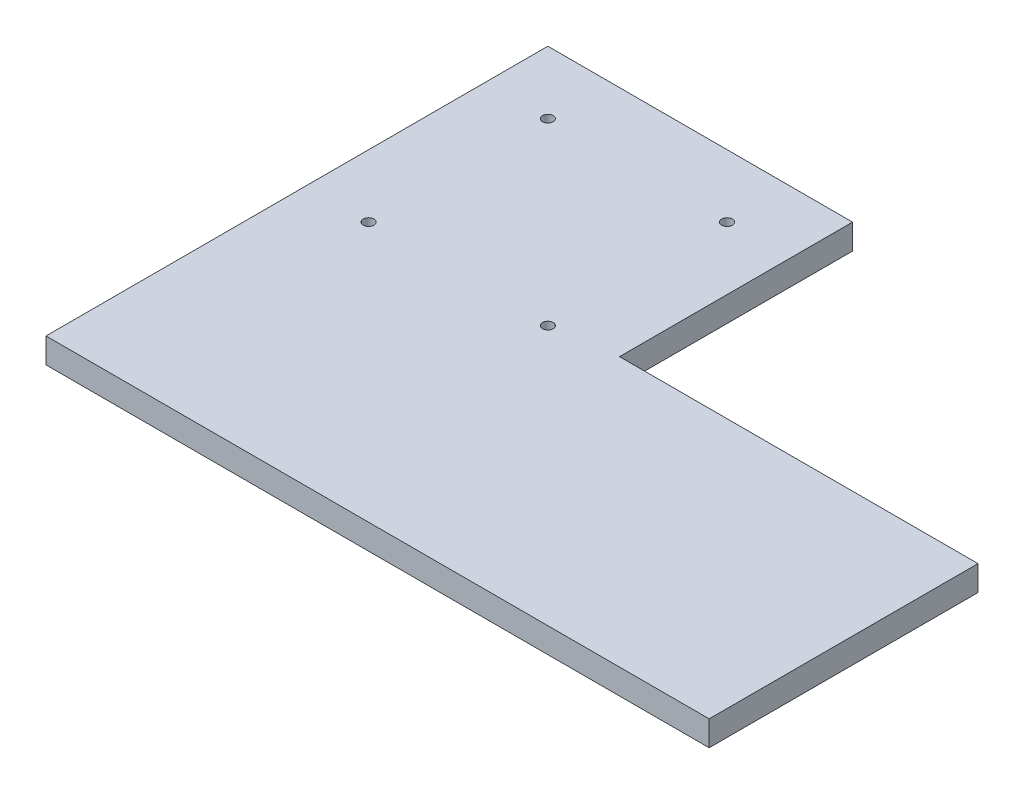
from build123d import *

# Parameters (mm, degrees)
BOSS_EXTRUDE1_DEPTH = 7
SKETCH2_R           = 1.5
CUT_EXTRUDE2_DEPTH  = 158.494075866


with BuildPart() as part:
    # Sketch1 → Boss-Extrude1 (new body)
    with BuildSketch(Plane(origin=(0, 0, 0), x_dir=(1, 0, 0), z_dir=(0, 1, 0))):
        Polygon((14.318293597, 31.894904459), (-70.681706403, 31.894904459), (-70.681706403, -108.105095541), (114.318293597, -108.105095541), (114.318293597, -33.105095541), (14.318293597, -33.105095541), align=None)
    extrude(amount=BOSS_EXTRUDE1_DEPTH)

    # Sketch2 → Cut-Extrude2 (cut, through all)
    with BuildSketch(Plane(origin=(0, 7, 0), x_dir=(1, 0, 0), z_dir=(0, 1, 0))):
        with Locations((-53.181706403, 14.394904459)):
            Circle(SKETCH2_R)
        with Locations((-3.181706403, 14.394904459)):
            Circle(SKETCH2_R)
        with Locations((-3.181706403, -35.605095541)):
            Circle(SKETCH2_R)
        with Locations((-53.181706403, -35.605095541)):
            Circle(SKETCH2_R)
    extrude(amount=-CUT_EXTRUDE2_DEPTH, mode=Mode.SUBTRACT)


solid = part.part
